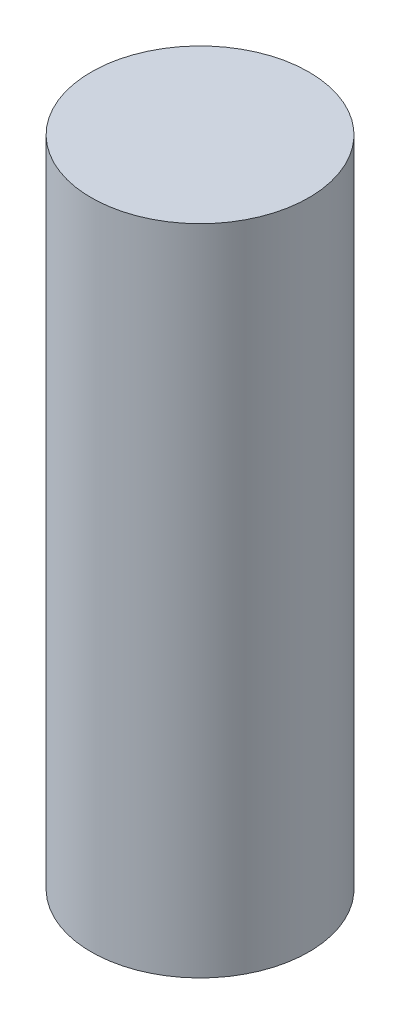
from build123d import *

# Parameters (mm, degrees)
SKETCH1_R           = 1.5875
BOSS_EXTRUDE1_DEPTH = 4.7625


with BuildPart() as part:
    # Sketch1 → Boss-Extrude1 (new, symmetric)
    with BuildSketch(Plane(origin=(0, 0, 0), x_dir=(1, 0, 0), z_dir=(0, 1, 0))):
        Circle(SKETCH1_R)
    extrude(amount=BOSS_EXTRUDE1_DEPTH, both=True)


solid = part.part
